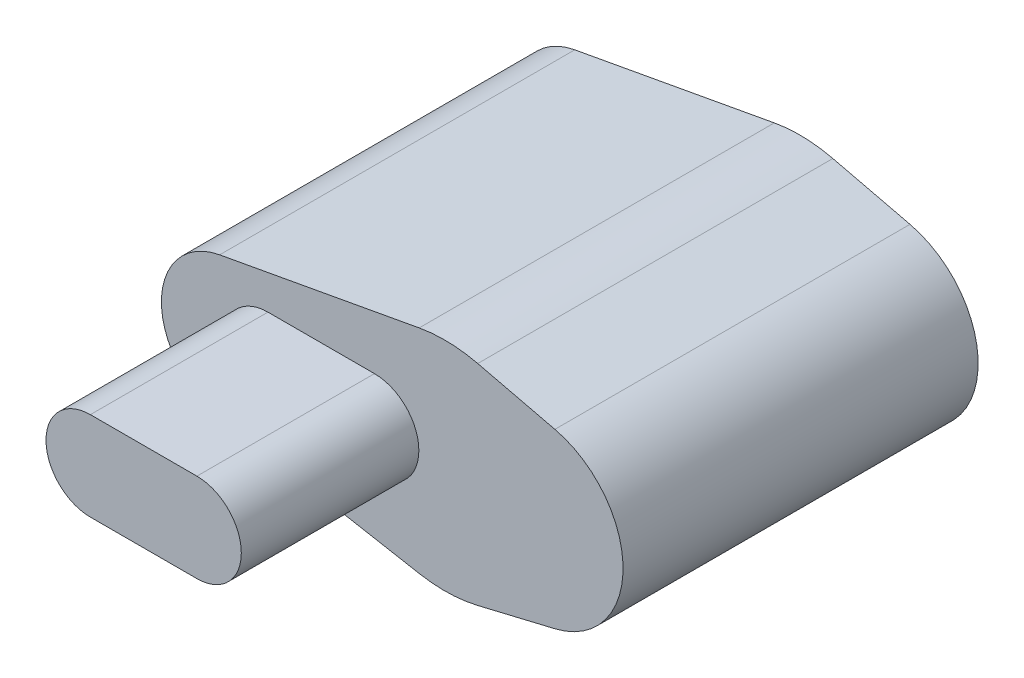
from build123d import *

# Parameters (mm, degrees)
EXTRUDE_1_DEPTH     = 200
FILLET_1_R          = 80
EXTRUDE_2_DEPTH     = 100
SKETCH_3_R          = 25
CUT_EXTRUDE_1_DEPTH = 160
EXTRUDE_START       = 12
SKETCH_4_R          = 25
EXTRUDE_3_DEPTH     = 12
SKETCH_5_R          = 28
EXTRUDE_4_DEPTH     = 4
SKETCH_6_R          = 20
EXTRUDE_5_DEPTH     = 10
CHAMFER_1_SIZE2     = 5
CHAMFER_1_SIZE      = 10
SKETCH_7_R          = 7
CUT_EXTRUDE_2_DEPTH = 200


with BuildPart() as part:
    # 草图1 → 凸台-拉伸1 (new body)
    with BuildSketch(Plane.XY):
        with BuildLine():
            ThreePointArc((11.613593767, -48.632545068), (50, 0), (11.613593767, 48.632545068))
            Line((11.613593767, 48.632545068), (-48.23619118, 62.924848473))
            Line((-48.23619118, 62.924848473), (-177.193873283, 39.347785035))
            ThreePointArc((-177.193873283, 39.347785035), (-210, 0), (-177.193873283, -39.347785035))
            Line((-177.193873283, -39.347785035), (-48.23619118, -62.924848473))
            Line((-48.23619118, -62.924848473), (11.613593767, -48.632545068))
        make_face()
    extrude(amount=EXTRUDE_1_DEPTH)

    # 圆角1
    fillet_1_edges = [part.edges().sort_by_distance(p)[0] for p in [
        (-48.23619118, -62.924848473, 100),
        (-48.23619118, 62.924848473, 100),
    ]]
    fillet(fillet_1_edges, radius=FILLET_1_R)

    # 草图2 → 凸台-拉伸2 (add)
    with BuildSketch(Plane.XY.offset(200)):
        with BuildLine():
            ThreePointArc((-125, 0), (-132.32233047, 17.67766953), (-150, 25))
            Line((-150, 25), (-150, -25))
            ThreePointArc((-150, -25), (-132.32233047, -17.67766953), (-125, 0))
        make_face()
        with BuildLine():
            Line((-150, -25), (-150, 25))
            ThreePointArc((-150, 25), (-175, 0), (-150, -25))
        make_face()
        with BuildLine():
            Line((-90, 25), (-150, 25))
            ThreePointArc((-150, 25), (-132.32233047, 17.67766953), (-125, 0))
            ThreePointArc((-125, 0), (-132.32233047, -17.67766953), (-150, -25))
            Line((-150, -25), (-90, -25))
            ThreePointArc((-90, -25), (-115, 0), (-90, 25))
        make_face()
        with BuildLine():
            ThreePointArc((-65, 0), (-72.32233047, 17.67766953), (-90, 25))
            Line((-90, 25), (-90, -25))
            ThreePointArc((-90, -25), (-72.32233047, -17.67766953), (-65, 0))
        make_face()
        with BuildLine():
            Line((-90, -25), (-90, 25))
            ThreePointArc((-90, 25), (-115, 0), (-90, -25))
        make_face()
    extrude(amount=EXTRUDE_2_DEPTH)

    # 草图3 → 切除-拉伸1 (cut)
    with BuildSketch(Plane(origin=(0, 0, 0), x_dir=(-1, 0, 0), z_dir=(0, 0, -1))):
        Circle(SKETCH_3_R)
    extrude(amount=-CUT_EXTRUDE_1_DEPTH, mode=Mode.SUBTRACT)

    # 草图4 → 凸台-拉伸3 (add)
    with BuildSketch(Plane(origin=(0, 0, 0), x_dir=(-1, 0, 0), z_dir=(0, 0, -1)).offset(EXTRUDE_START)):
        with Locations(Location((150, 0, 0), (0, 0, 180))):
            Circle(SKETCH_4_R)
    extrude(amount=-EXTRUDE_3_DEPTH)

    # 草图5 → 凸台-拉伸4 (add)
    with BuildSketch(Plane(origin=(0, 0, -12), x_dir=(-1, 0, 0), z_dir=(0, 0, -1))):
        with Locations((150, 0)):
            Circle(SKETCH_5_R)
    extrude(amount=EXTRUDE_4_DEPTH)

    # 草图6 → 凸台-拉伸5 (add)
    with BuildSketch(Plane(origin=(0, 0, -16), x_dir=(-1, 0, 0), z_dir=(0, 0, -1))):
        with Locations((150, 0)):
            Circle(SKETCH_6_R)
    extrude(amount=EXTRUDE_5_DEPTH)

    # 倒角1
    chamfer_1_edges = [part.edges().sort_by_distance(p)[0] for p in [
        (-130, 0, -26),
    ]]
    chamfer_1_side = [part.faces().sort_by_distance(p)[0] for p in [
        (-130, 0, -25.9),
    ]]
    chamfer(chamfer_1_edges, length=CHAMFER_1_SIZE - 0.0001, length2=CHAMFER_1_SIZE2 - 0.0001, reference=chamfer_1_side[0])  # a hair under: the kernel refuses the full size

    # 草图7 → 切除-拉伸2 (cut)
    with BuildSketch(Plane(origin=(0, 0, -26), x_dir=(-1, 0, 0), z_dir=(0, 0, -1))):
        with Locations((150, 0)):
            Circle(SKETCH_7_R)
    extrude(amount=-CUT_EXTRUDE_2_DEPTH, mode=Mode.SUBTRACT)


solid = part.part
